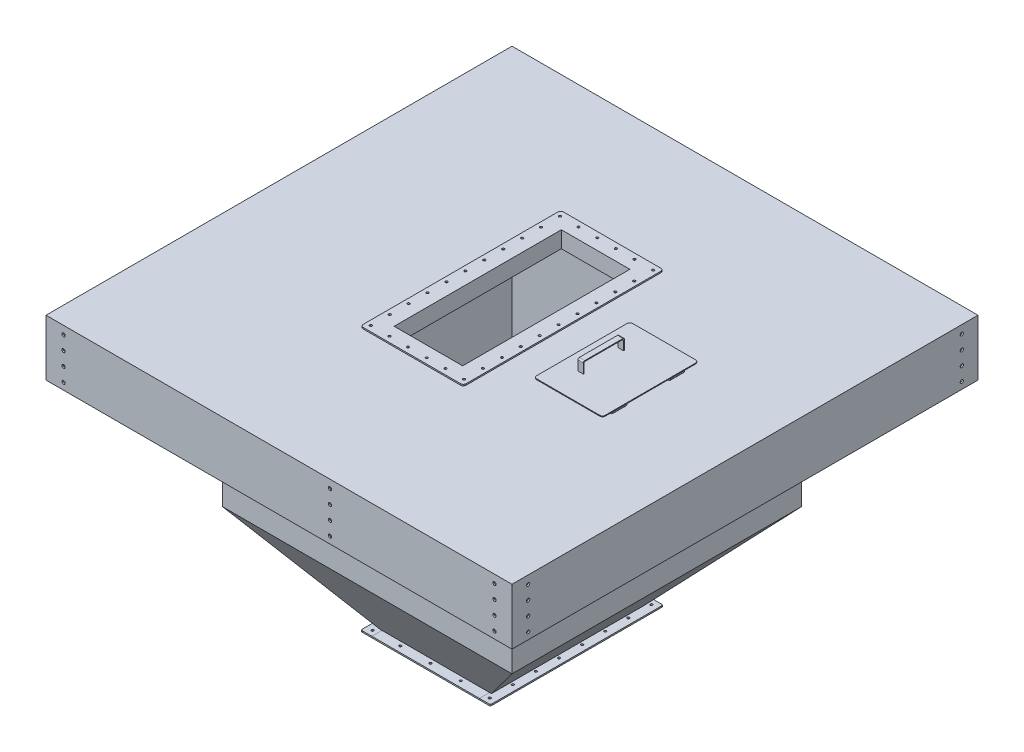
from build123d import *

# Parameters (mm, degrees)
SKETCH1_W                 = 1700
SKETCH1_H                 = 1700
SKETCH1_W_2               = 250
SKETCH1_H_2               = 610
BOSS_EXTRUDE1_DEPTH       = 5
SKETCH5_W                 = 1700
SKETCH5_H                 = 200
SKETCH5_R                 = 6
BOSS_EXTRUDE2_DEPTH       = 5
SKETCH7_W                 = 1690
SKETCH7_H                 = 200
SKETCH7_R                 = 6
BOSS_EXTRUDE3_DEPTH       = 5
SKETCH8_R                 = 6
CUT_EXTRUDE1_DEPTH        = 5
SKETCH9_W                 = 1056
SKETCH9_H                 = 1056
SKETCH9_W_2               = 1046
SKETCH9_H_2               = 1046
EXTRUDE_THIN1_DEPTH       = 600
SHELL1_T                  = -5
SKETCH13_R                = 4.25
BOSS_EXTRUDE5_DEPTH       = 5
SKETCH14_W                = 392.35359059
SKETCH14_H                = 43.144518048
SKETCH14_R                = 4.25
BOSS_EXTRUDE6_DEPTH       = 5
BOSS_EXTRUDE6_2_DEPTH     = 5
SKETCH15_W                = 5
SKETCH15_H                = 1046
SKETCH15_W_2              = 298
SKETCH15_H_2              = 5
EXTRUDE_THIN2_DEPTH       = 60
EXTRUDE_THIN3_OUTLINE_W   = 5
EXTRUDE_THIN3_OUTLINE_H   = 317
EXTRUDE_THIN3_OUTLINE_W_2 = 317
EXTRUDE_THIN3_OUTLINE_H_2 = 5
EXTRUDE_THIN3_DEPTH       = 200
MIRROR6_START             = -528
MIRROR6_OUTLINE_W         = 200
MIRROR6_OUTLINE_H         = 317
MIRROR6_DEPTH             = 5
MIRROR6_START_2           = -184.67
MIRROR6_2_OUTLINE_W       = 200
MIRROR6_2_OUTLINE_H       = 317
MIRROR6_2_DEPTH           = 5
MIRROR6_START_3           = 163.66
MIRROR6_3_OUTLINE_W       = 200
MIRROR6_3_OUTLINE_H       = 317
MIRROR6_3_DEPTH           = 5
MIRROR6_START_4           = 511.99
MIRROR6_4_OUTLINE_W       = 200
MIRROR6_4_OUTLINE_H       = 317
MIRROR6_4_DEPTH           = 5
MIRROR7_START             = -516.299490473
MIRROR7_OUTLINE_W         = 317
MIRROR7_OUTLINE_H         = 200
MIRROR7_DEPTH             = 5
MIRROR7_START_2           = -179.67
MIRROR7_2_OUTLINE_W       = 317
MIRROR7_2_OUTLINE_H       = 200
MIRROR7_2_DEPTH           = 5
MIRROR7_START_3           = 168.66
MIRROR7_3_OUTLINE_W       = 317
MIRROR7_3_OUTLINE_H       = 200
MIRROR7_3_DEPTH           = 5
MIRROR7_START_4           = 516.99
MIRROR7_4_OUTLINE_W       = 317
MIRROR7_4_OUTLINE_H       = 200
MIRROR7_4_DEPTH           = 5
SKETCH17_R                = 4
SKETCH17_W                = 130
SKETCH17_H                = 130
CUT_EXTRUDE2_DEPTH        = 5
SKETCH18_W                = 260
SKETCH18_H                = 620
SKETCH18_W_2              = 250
SKETCH18_H_2              = 610
EXTRUDE_THIN4_DEPTH       = 50
EXTRUDE_THIN5_DEPTH       = 16
SKETCH20_R                = 4.25
SKETCH20_W                = 250
SKETCH20_H                = 610
BOSS_EXTRUDE7_DEPTH       = 5
SKETCH21_R                = 8
BOSS_EXTRUDE8_DEPTH       = 130
SKETCH22_W                = 160
SKETCH22_H                = 16
CUT_EXTRUDE4_DEPTH        = 16
BOSS_EXTRUDE9_DEPTH       = 3
SKETCH24_W                = 20
SKETCH24_H                = 150
BOSS_EXTRUDE10_DEPTH      = 40
SKETCH25_W                = 144
SKETCH25_H                = 37
CUT_EXTRUDE5_DEPTH        = 20
FILLET1_R                 = 5
SKETCH26_R                = 6
CUT_EXTRUDE6_DEPTH        = 5


# Read off the part's stored shape, not the designer's step: Extrude-Thin3, Mirror6, Mirror7, Extrude-Thin5
with BuildPart() as part:
    # Sketch1 → Boss-Extrude1 (new body)
    with BuildSketch(Plane(origin=(0, 0, 0), x_dir=(1, 0, 0), z_dir=(0, 1, 0))):
        Rectangle(SKETCH1_W, SKETCH1_H)
        Rectangle(SKETCH1_W_2, SKETCH1_H_2, mode=Mode.SUBTRACT)
        with BuildLine():
            Line((285, 150), (475, 150))
            ThreePointArc((475, 150), (478.535533906, 148.535533906), (480, 145))
            Line((480, 145), (480, -145))
            ThreePointArc((480, -145), (478.535533906, -148.535533906), (475, -150))
            Line((475, -150), (285, -150))
            ThreePointArc((285, -150), (281.464466094, -148.535533906), (280, -145))
            Line((280, -145), (280, 145))
            ThreePointArc((280, 145), (281.464466094, 148.535533906), (285, 150))
        make_face(mode=Mode.SUBTRACT)
    extrude(amount=BOSS_EXTRUDE1_DEPTH)



with BuildPart() as body_2:
    # Sketch5 → Boss-Extrude2 (new body)
    with BuildSketch(Plane.ZY.offset(850)):
        with Locations((0, -100)):
            Rectangle(SKETCH5_W, SKETCH5_H)
        with Locations((-791, -25)):
            Circle(SKETCH5_R, mode=Mode.SUBTRACT)
        with Locations((-791, -75)):
            Circle(SKETCH5_R, mode=Mode.SUBTRACT)
        with Locations((-791, -125)):
            Circle(SKETCH5_R, mode=Mode.SUBTRACT)
        with Locations((-791, -175)):
            Circle(SKETCH5_R, mode=Mode.SUBTRACT)
        with Locations(Location((791, -175, 0), (0, 0, 180))):
            Circle(SKETCH5_R, mode=Mode.SUBTRACT)
        with Locations(Location((791, -125, 0), (0, 0, 180))):
            Circle(SKETCH5_R, mode=Mode.SUBTRACT)
        with Locations(Location((791, -75, 0), (0, 0, 180))):
            Circle(SKETCH5_R, mode=Mode.SUBTRACT)
        with Locations(Location((791, -25, 0), (0, 0, 180))):
            Circle(SKETCH5_R, mode=Mode.SUBTRACT)
    extrude(amount=-BOSS_EXTRUDE2_DEPTH)


with BuildPart() as body_3:
    # Mirror1: mirrored copy
    add(body_2.part.mirror(Plane(origin=(0, 0, 0), x_dir=(0, 0, 1), z_dir=(1, 0, 0))))


with BuildPart() as part_1:
    add(part.part)

    add(body_2.part)  # Boss-Extrude3 merges body 2

    add(body_3.part)  # Boss-Extrude3 merges body 3
    # Sketch7 → Boss-Extrude3 (add)
    with BuildSketch(Plane.XY.offset(850)):
        with Locations((0, -100)):
            Rectangle(SKETCH7_W, SKETCH7_H)
        with Locations((786, -175)):
            Circle(SKETCH7_R, mode=Mode.SUBTRACT)
        with Locations((786, -125)):
            Circle(SKETCH7_R, mode=Mode.SUBTRACT)
        with Locations((786, -75)):
            Circle(SKETCH7_R, mode=Mode.SUBTRACT)
        with Locations((786, -25)):
            Circle(SKETCH7_R, mode=Mode.SUBTRACT)
        with Locations(Location((-786, -25, 0), (0, 0, 180))):
            Circle(SKETCH7_R, mode=Mode.SUBTRACT)
        with Locations(Location((-786, -75, 0), (0, 0, 180))):
            Circle(SKETCH7_R, mode=Mode.SUBTRACT)
        with Locations(Location((-786, -125, 0), (0, 0, 180))):
            Circle(SKETCH7_R, mode=Mode.SUBTRACT)
        with Locations(Location((-786, -175, 0), (0, 0, 180))):
            Circle(SKETCH7_R, mode=Mode.SUBTRACT)
    boss_extrude3 = extrude(amount=-BOSS_EXTRUDE3_DEPTH)

    # Mirror2: Boss-Extrude3 across plane
    add(boss_extrude3.mirror(Plane.XY))

    # Sketch8 → Cut-Extrude1 (cut)
    with BuildSketch(Plane(origin=(0, 0, -850), x_dir=(-1, 0, 0), z_dir=(0, 0, -1))):
        with Locations((-186, -20)):
            Circle(SKETCH8_R)
        with Locations((-186, -70)):
            Circle(SKETCH8_R)
        with Locations((-186, -120)):
            Circle(SKETCH8_R)
        with Locations((-186, -170)):
            Circle(SKETCH8_R)
    extrude(amount=-CUT_EXTRUDE1_DEPTH, mode=Mode.SUBTRACT)



with BuildPart() as body_2_2:
    # Sketch9 → Extrude-Thin1 (new body)
    with BuildSketch(Plane.XZ):
        Rectangle(SKETCH9_W, SKETCH9_H)
        Rectangle(SKETCH9_W_2, SKETCH9_H_2, mode=Mode.SUBTRACT)
    extrude(amount=EXTRUDE_THIN1_DEPTH)


with BuildPart() as body_3_2:
    # Sketch10 → Loft2 section 0
    with BuildSketch(Plane(origin=(0, -950, 0), x_dir=(-1, 0, 0), z_dir=(0, -1, 0))):
        with BuildLine():
            Line((-203, -278), (203, -278))
            Line((203, -278), (203, 278))
            Line((203, 278), (-203, 278))
            Line((-203, 278), (-203, -278))
        make_face()
    # Sketch12 → Loft2 section 1
    with BuildSketch(Plane.XZ.offset(600)):
        with BuildLine():
            Line((-528, 528), (-528, -528))
            Line((-528, -528), (528, -528))
            Line((528, -528), (528, 528))
            Line((528, 528), (-528, 528))
        make_face()
    loft()

    # Shell1
    shell1_openings = [body_3_2.faces().sort_by_distance(p)[0] for p in [
        (0, -600, 0),
        (0, -950, 0),
    ]]
    offset(amount=SHELL1_T, openings=shell1_openings, kind=Kind.INTERSECTION)


with BuildPart() as body_4:
    # Sketch13 → Boss-Extrude5 (new body)
    with BuildSketch(Plane.XZ.offset(950)):
        with BuildLine():
            Line((196.176795295, 315), (196.176795295, -315))
            Line((196.176795295, -315), (231.176795295, -315))
            ThreePointArc((231.176795295, -315), (234.712329201, -313.535533906), (236.176795295, -310))
            Line((236.176795295, -310), (236.176795295, 310))
            ThreePointArc((236.176795295, 310), (234.712329201, 313.535533906), (231.176795295, 315))
            Line((231.176795295, 315), (196.176795295, 315))
        make_face()
        with Locations(Location((213.676795295, 295, 0), (0, 0, 270))):
            Circle(SKETCH13_R, mode=Mode.SUBTRACT)
        with Locations(Location((213.676795295, 210.71, 0), (0, 0, 270))):
            Circle(SKETCH13_R, mode=Mode.SUBTRACT)
        with Locations(Location((213.676795295, 126.42, 0), (0, 0, 270))):
            Circle(SKETCH13_R, mode=Mode.SUBTRACT)
        with Locations(Location((213.676795295, 42.13, 0), (0, 0, 270))):
            Circle(SKETCH13_R, mode=Mode.SUBTRACT)
        with Locations(Location((213.676795295, -42.16, 0), (0, 0, 270))):
            Circle(SKETCH13_R, mode=Mode.SUBTRACT)
        with Locations(Location((213.676795295, -126.45, 0), (0, 0, 270))):
            Circle(SKETCH13_R, mode=Mode.SUBTRACT)
        with Locations(Location((213.676795295, -210.74, 0), (0, 0, 270))):
            Circle(SKETCH13_R, mode=Mode.SUBTRACT)
        with Locations(Location((213.676795295, -295.03, 0), (0, 0, 270))):
            Circle(SKETCH13_R, mode=Mode.SUBTRACT)
    extrude(amount=BOSS_EXTRUDE5_DEPTH)


with BuildPart() as body_5:
    # Mirror5: mirrored copy
    add(body_4.part.mirror(Plane(origin=(0, 0, 0), x_dir=(0, 0, 1), z_dir=(1, 0, 0))))


with BuildPart() as body_6:
    # Sketch14 → Boss-Extrude6 (new body)
    with BuildSketch(Plane.XZ.offset(950)):
        with Locations((0, 293.427740976)):
            Rectangle(SKETCH14_W, SKETCH14_H)
        with Locations(Location((106.176795295, 293.427740976, 0), (0, 0, 270))):
            Circle(SKETCH14_R, mode=Mode.SUBTRACT)
        with Locations(Location((-3.823204705, 293.427740976, 0), (0, 0, 270))):
            Circle(SKETCH14_R, mode=Mode.SUBTRACT)
        with Locations(Location((-113.823204705, 293.427740976, 0), (0, 0, 270))):
            Circle(SKETCH14_R, mode=Mode.SUBTRACT)
    extrude(amount=BOSS_EXTRUDE6_DEPTH)


with BuildPart() as body_7:
    # Sketch14 → Boss-Extrude6 2 (new body)
    with BuildSketch(Plane.XZ.offset(950)):
        with Locations((0, -293.427740976)):
            Rectangle(SKETCH14_W, SKETCH14_H)
        with Locations(Location((-113.823204705, -293.427740976, 0), (0, 0, 90))):
            Circle(SKETCH14_R, mode=Mode.SUBTRACT)
        with Locations(Location((-3.823204705, -293.427740976, 0), (0, 0, 90))):
            Circle(SKETCH14_R, mode=Mode.SUBTRACT)
        with Locations(Location((106.176795295, -293.427740976, 0), (0, 0, 90))):
            Circle(SKETCH14_R, mode=Mode.SUBTRACT)
    extrude(amount=BOSS_EXTRUDE6_2_DEPTH)


with BuildPart() as part_2:
    add(part_1.part)

    add(body_2_2.part)  # Extrude-Thin2 merges body 2 2
    # Sketch15 → Extrude-Thin2 (add)
    with BuildSketch(Plane.XZ):
        with Locations((-222.5, 0)):
            Rectangle(SKETCH15_W, SKETCH15_H)
        with Locations((222.5, 0)):
            Rectangle(SKETCH15_W, SKETCH15_H)
        with Locations((-374, 0)):
            Rectangle(SKETCH15_W_2, SKETCH15_H_2)
        with Locations((374, 200)):
            Rectangle(SKETCH15_W_2, SKETCH15_H_2)
        with Locations((374, -200)):
            Rectangle(SKETCH15_W_2, SKETCH15_H_2)
    extrude(amount=EXTRUDE_THIN2_DEPTH)

    # Sketch17 → Cut-Extrude2 (cut)
    with BuildSketch(Plane.XY.offset(528)):
        with Locations((-85, -30)):
            Circle(SKETCH17_R)
        with Locations((-85, -200)):
            Circle(SKETCH17_R)
        with Locations((85, -200)):
            Circle(SKETCH17_R)
        with Locations((85, -30)):
            Circle(SKETCH17_R)
        with Locations((0, -115)):
            Rectangle(SKETCH17_W, SKETCH17_H)
    extrude(amount=-CUT_EXTRUDE2_DEPTH, mode=Mode.SUBTRACT)

    # Sketch18 → Extrude-Thin4 (add)
    with BuildSketch(Plane(origin=(0, 5, 0), x_dir=(1, 0, 0), z_dir=(0, 1, 0))):
        Rectangle(SKETCH18_W, SKETCH18_H)
        Rectangle(SKETCH18_W_2, SKETCH18_H_2, mode=Mode.SUBTRACT)
    extrude(amount=EXTRUDE_THIN4_DEPTH)

    # Extrude-Thin5 outline → Extrude-Thin5 (add)
    with BuildSketch(Plane(origin=(0, 5, 0), x_dir=(1, 0, 0), z_dir=(0, 1, 0))):
        with BuildLine():
            ThreePointArc((277, -145), (279.343145751, -150.656854249), (285, -153))
            Line((285, -153), (475, -153))
            ThreePointArc((475, -153), (480.656854249, -150.656854249), (483, -145))
            Line((483, -145), (483, 145))
            ThreePointArc((483, 145), (480.656854249, 150.656854249), (475, 153))
            Line((475, 153), (285, 153))
            ThreePointArc((285, 153), (279.343145751, 150.656854249), (277, 145))
            Line((277, 145), (277, -145))
        make_face()
        with BuildLine():
            Line((285, 150), (475, 150))
            ThreePointArc((475, 150), (478.535533906, 148.535533906), (480, 145))
            Line((480, 145), (480, -145))
            ThreePointArc((480, -145), (478.535533906, -148.535533906), (475, -150))
            Line((475, -150), (285, -150))
            ThreePointArc((285, -150), (281.464466094, -148.535533906), (280, -145))
            Line((280, -145), (280, 145))
            ThreePointArc((280, 145), (281.464466094, 148.535533906), (285, 150))
        make_face(mode=Mode.SUBTRACT)
    extrude(amount=EXTRUDE_THIN5_DEPTH)

    # Sketch20 → Boss-Extrude7 (add)
    with BuildSketch(Plane(origin=(0, 55, 0), x_dir=(1, 0, 0), z_dir=(0, 1, 0))):
        with BuildLine():
            Line((-177.5, 365), (177.5, 365))
            ThreePointArc((177.5, 365), (184.571067812, 362.071067812), (187.5, 355))
            Line((187.5, 355), (187.5, -355))
            ThreePointArc((187.5, -355), (184.571067812, -362.071067812), (177.5, -365))
            Line((177.5, -365), (-177.5, -365))
            ThreePointArc((-177.5, -365), (-184.571067812, -362.071067812), (-187.5, -355))
            Line((-187.5, -355), (-187.5, 355))
            ThreePointArc((-187.5, 355), (-184.571067812, 362.071067812), (-177.5, 365))
        make_face()
        with Locations(Location((-170, 345, 0), (0, 0, 270))):
            Circle(SKETCH20_R, mode=Mode.SUBTRACT)
        with Locations(Location((-102, 345, 0), (0, 0, 270))):
            Circle(SKETCH20_R, mode=Mode.SUBTRACT)
        with Locations(Location((-34, 345, 0), (0, 0, 270))):
            Circle(SKETCH20_R, mode=Mode.SUBTRACT)
        with Locations(Location((34, 345, 0), (0, 0, 270))):
            Circle(SKETCH20_R, mode=Mode.SUBTRACT)
        with Locations(Location((102, 345, 0), (0, 0, 270))):
            Circle(SKETCH20_R, mode=Mode.SUBTRACT)
        with Locations(Location((170, 345, 0), (0, 0, 270))):
            Circle(SKETCH20_R, mode=Mode.SUBTRACT)
        with Locations(Location((-102, -345, 0), (0, 0, 270))):
            Circle(SKETCH20_R, mode=Mode.SUBTRACT)
        with Locations(Location((-34, -345, 0), (0, 0, 270))):
            Circle(SKETCH20_R, mode=Mode.SUBTRACT)
        with Locations(Location((34, -345, 0), (0, 0, 270))):
            Circle(SKETCH20_R, mode=Mode.SUBTRACT)
        with Locations(Location((102, -345, 0), (0, 0, 270))):
            Circle(SKETCH20_R, mode=Mode.SUBTRACT)
        with Locations(Location((170, -345, 0), (0, 0, 270))):
            Circle(SKETCH20_R, mode=Mode.SUBTRACT)
        with Locations(Location((-170, -345, 0), (0, 0, 270))):
            Circle(SKETCH20_R, mode=Mode.SUBTRACT)
        with Locations(Location((-170, 276, 0), (0, 0, 270))):
            Circle(SKETCH20_R, mode=Mode.SUBTRACT)
        with Locations(Location((170, 276, 0), (0, 0, 270))):
            Circle(SKETCH20_R, mode=Mode.SUBTRACT)
        with Locations(Location((-170, 207, 0), (0, 0, 270))):
            Circle(SKETCH20_R, mode=Mode.SUBTRACT)
        with Locations(Location((170, 207, 0), (0, 0, 270))):
            Circle(SKETCH20_R, mode=Mode.SUBTRACT)
        with Locations(Location((-170, 138, 0), (0, 0, 270))):
            Circle(SKETCH20_R, mode=Mode.SUBTRACT)
        with Locations(Location((170, 138, 0), (0, 0, 270))):
            Circle(SKETCH20_R, mode=Mode.SUBTRACT)
        with Locations(Location((-170, 69, 0), (0, 0, 270))):
            Circle(SKETCH20_R, mode=Mode.SUBTRACT)
        with Locations(Location((170, 69, 0), (0, 0, 270))):
            Circle(SKETCH20_R, mode=Mode.SUBTRACT)
        with Locations(Location((-170, 0, 0), (0, 0, 270))):
            Circle(SKETCH20_R, mode=Mode.SUBTRACT)
        with Locations(Location((170, 0, 0), (0, 0, 270))):
            Circle(SKETCH20_R, mode=Mode.SUBTRACT)
        with Locations(Location((-170, -69, 0), (0, 0, 270))):
            Circle(SKETCH20_R, mode=Mode.SUBTRACT)
        with Locations(Location((170, -69, 0), (0, 0, 270))):
            Circle(SKETCH20_R, mode=Mode.SUBTRACT)
        with Locations(Location((-170, -138, 0), (0, 0, 270))):
            Circle(SKETCH20_R, mode=Mode.SUBTRACT)
        with Locations(Location((170, -138, 0), (0, 0, 270))):
            Circle(SKETCH20_R, mode=Mode.SUBTRACT)
        with Locations(Location((-170, -207, 0), (0, 0, 270))):
            Circle(SKETCH20_R, mode=Mode.SUBTRACT)
        with Locations(Location((170, -207, 0), (0, 0, 270))):
            Circle(SKETCH20_R, mode=Mode.SUBTRACT)
        with Locations(Location((-170, -276, 0), (0, 0, 270))):
            Circle(SKETCH20_R, mode=Mode.SUBTRACT)
        with Locations(Location((170, -276, 0), (0, 0, 270))):
            Circle(SKETCH20_R, mode=Mode.SUBTRACT)
        Rectangle(SKETCH20_W, SKETCH20_H, mode=Mode.SUBTRACT)
    extrude(amount=BOSS_EXTRUDE7_DEPTH)



with BuildPart() as body_7_2:
    # Extrude-Thin3 outline → Extrude-Thin3 (new body)
    with BuildSketch(Plane.XZ):
        with Locations((-525.5, -686.5)):
            Rectangle(EXTRUDE_THIN3_OUTLINE_W, EXTRUDE_THIN3_OUTLINE_H)
        with Locations((-686.5, -513.799490473)):
            Rectangle(EXTRUDE_THIN3_OUTLINE_W_2, EXTRUDE_THIN3_OUTLINE_H_2)
        with Locations((-686.5, -177.17)):
            Rectangle(EXTRUDE_THIN3_OUTLINE_W_2, EXTRUDE_THIN3_OUTLINE_H_2)
        with Locations((-686.5, 171.16)):
            Rectangle(EXTRUDE_THIN3_OUTLINE_W_2, EXTRUDE_THIN3_OUTLINE_H_2)
        with Locations((-686.5, 519.49)):
            Rectangle(EXTRUDE_THIN3_OUTLINE_W_2, EXTRUDE_THIN3_OUTLINE_H_2)
        with Locations((514.49, -686.5)):
            Rectangle(EXTRUDE_THIN3_OUTLINE_W, EXTRUDE_THIN3_OUTLINE_H)
        with Locations((166.16, -686.5)):
            Rectangle(EXTRUDE_THIN3_OUTLINE_W, EXTRUDE_THIN3_OUTLINE_H)
        with Locations((-182.17, -686.5)):
            Rectangle(EXTRUDE_THIN3_OUTLINE_W, EXTRUDE_THIN3_OUTLINE_H)
    extrude(amount=EXTRUDE_THIN3_DEPTH)


with BuildPart() as body_8:
    # Mirror6 outline → Mirror6 (new body)
    with BuildSketch(Plane.YZ.offset(MIRROR6_START)):
        with Locations((-100, 686.5)):
            Rectangle(MIRROR6_OUTLINE_W, MIRROR6_OUTLINE_H)
    extrude(amount=MIRROR6_DEPTH)


with BuildPart() as body_9:
    # Mirror6 2 outline → Mirror6 2 (new body)
    with BuildSketch(Plane.YZ.offset(MIRROR6_START_2)):
        with Locations((-100, 686.5)):
            Rectangle(MIRROR6_2_OUTLINE_W, MIRROR6_2_OUTLINE_H)
    extrude(amount=MIRROR6_2_DEPTH)


with BuildPart() as body_10:
    # Mirror6 3 outline → Mirror6 3 (new body)
    with BuildSketch(Plane.YZ.offset(MIRROR6_START_3)):
        with Locations((-100, 686.5)):
            Rectangle(MIRROR6_3_OUTLINE_W, MIRROR6_3_OUTLINE_H)
    extrude(amount=MIRROR6_3_DEPTH)


with BuildPart() as body_11:
    # Mirror6 4 outline → Mirror6 4 (new body)
    with BuildSketch(Plane.YZ.offset(MIRROR6_START_4)):
        with Locations((-100, 686.5)):
            Rectangle(MIRROR6_4_OUTLINE_W, MIRROR6_4_OUTLINE_H)
    extrude(amount=MIRROR6_4_DEPTH)


with BuildPart() as body_12:
    # Mirror7 outline → Mirror7 (new body)
    with BuildSketch(Plane.XY.offset(MIRROR7_START)):
        with Locations((686.5, -100)):
            Rectangle(MIRROR7_OUTLINE_W, MIRROR7_OUTLINE_H)
    extrude(amount=MIRROR7_DEPTH)


with BuildPart() as body_13:
    # Mirror7 2 outline → Mirror7 2 (new body)
    with BuildSketch(Plane.XY.offset(MIRROR7_START_2)):
        with Locations((686.5, -100)):
            Rectangle(MIRROR7_2_OUTLINE_W, MIRROR7_2_OUTLINE_H)
    extrude(amount=MIRROR7_2_DEPTH)


with BuildPart() as body_14:
    # Mirror7 3 outline → Mirror7 3 (new body)
    with BuildSketch(Plane.XY.offset(MIRROR7_START_3)):
        with Locations((686.5, -100)):
            Rectangle(MIRROR7_3_OUTLINE_W, MIRROR7_3_OUTLINE_H)
    extrude(amount=MIRROR7_3_DEPTH)


with BuildPart() as body_15:
    # Mirror7 4 outline → Mirror7 4 (new body)
    with BuildSketch(Plane.XY.offset(MIRROR7_START_4)):
        with Locations((686.5, -100)):
            Rectangle(MIRROR7_4_OUTLINE_W, MIRROR7_4_OUTLINE_H)
    extrude(amount=MIRROR7_4_DEPTH)


with BuildPart() as body_16:
    # Sketch21 → Boss-Extrude8 (new, symmetric)
    with BuildSketch(Plane.XY):
        with Locations((491, 13)):
            Circle(SKETCH21_R)
    extrude(amount=BOSS_EXTRUDE8_DEPTH, both=True)

    # Sketch22 → Cut-Extrude4 (cut)
    with BuildSketch(Plane(origin=(483, 0, 0), x_dir=(0, 0, -1), z_dir=(1, 0, 0))):
        with Locations((0, 13)):
            Rectangle(SKETCH22_W, SKETCH22_H)
    extrude(amount=CUT_EXTRUDE4_DEPTH, mode=Mode.SUBTRACT)


with BuildPart() as cut_extrude4_piece_1:
    # of the separate pieces the step leaves, piece 1, a body of its own (cut_extrude4_pieces)
    add(body_16.part.solids().sort_by_distance((499, 13, 80))[0])


with BuildPart() as cut_extrude4_piece_2:
    # of the separate pieces the step leaves, piece 2, a body of its own (cut_extrude4_pieces)
    add(body_16.part.solids().sort_by_distance((499, 13, -130))[0])


with BuildPart() as body_18:
    # Sketch23 → Boss-Extrude9 (new body)
    with BuildSketch(Plane(origin=(0, 21, 0), x_dir=(1, 0, 0), z_dir=(0, 1, 0))):
        with BuildLine():
            Line((265, -175), (495, -175))
            ThreePointArc((495, -175), (502.071067812, -172.071067812), (505, -165))
            Line((505, -165), (505, 165))
            ThreePointArc((505, 165), (502.071067812, 172.071067812), (495, 175))
            Line((495, 175), (265, 175))
            ThreePointArc((265, 175), (257.928932188, 172.071067812), (255, 165))
            Line((255, 165), (255, -165))
            ThreePointArc((255, -165), (257.928932188, -172.071067812), (265, -175))
        make_face()
    extrude(amount=BOSS_EXTRUDE9_DEPTH)


with BuildPart() as part_3:
    add(part_2.part)

    add(body_18.part)  # Boss-Extrude10 merges body 18
    # Sketch24 → Boss-Extrude10 (add)
    with BuildSketch(Plane(origin=(0, 24, 0), x_dir=(1, 0, 0), z_dir=(0, 1, 0))):
        with Locations((325, 0)):
            Rectangle(SKETCH24_W, SKETCH24_H)
    extrude(amount=BOSS_EXTRUDE10_DEPTH)

    # Sketch25 → Cut-Extrude5 (cut)
    with BuildSketch(Plane(origin=(335, 0, 0), x_dir=(0, 0, -1), z_dir=(1, 0, 0))):
        with Locations((0, 42.5)):
            Rectangle(SKETCH25_W, SKETCH25_H)
    extrude(amount=-CUT_EXTRUDE5_DEPTH, mode=Mode.SUBTRACT)

    # Fillet1
    fillet1_edges = [part_3.edges().sort_by_distance(p)[0] for p in [
        (325, 64, 75),
        (325, 64, -75),
        (325, 61, 72),
        (325, 61, -72),
    ]]
    fillet(fillet1_edges, radius=FILLET1_R)

    # Sketch26 → Cut-Extrude6 (cut)
    with BuildSketch(Plane.XY.offset(850)):
        with Locations((186, -25)):
            Circle(SKETCH26_R)
        with Locations((186, -75)):
            Circle(SKETCH26_R)
        with Locations((186, -125)):
            Circle(SKETCH26_R)
        with Locations((186, -175)):
            Circle(SKETCH26_R)
    extrude(amount=-CUT_EXTRUDE6_DEPTH, mode=Mode.SUBTRACT)


solid = Compound([body_3_2.part, body_4.part, body_5.part, body_6.part, body_7.part, body_7_2.part, body_8.part, body_9.part, body_10.part, body_11.part, body_12.part, body_13.part, body_14.part, body_15.part, cut_extrude4_piece_1.part, cut_extrude4_piece_2.part, part_3.part])
